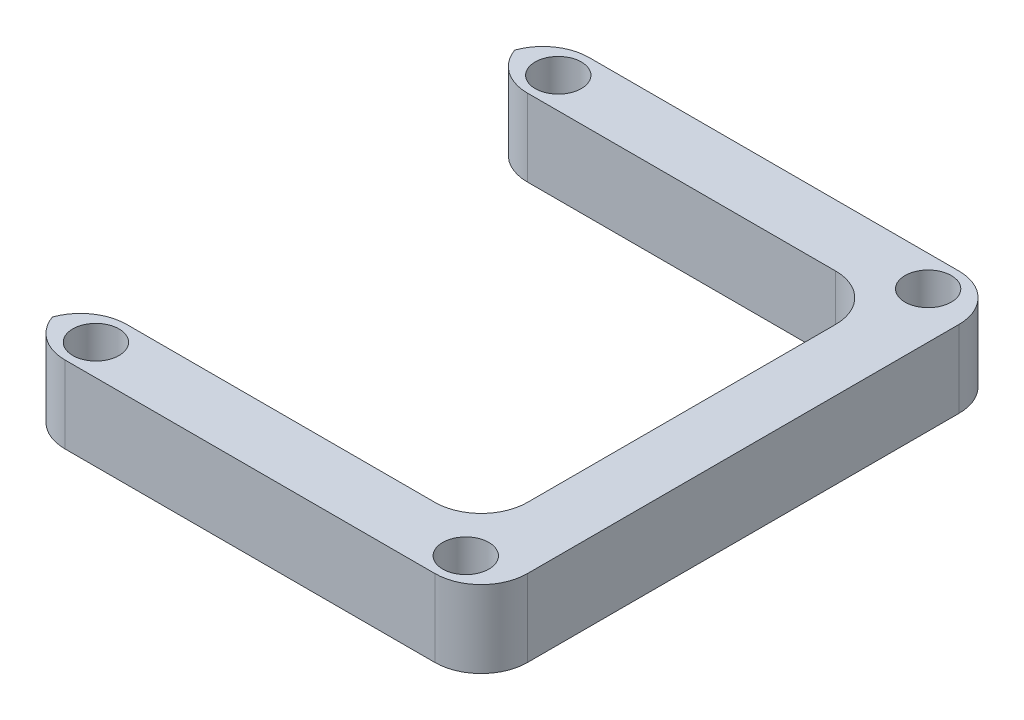
from build123d import *

# Parameters (mm, degrees)
SKETCH1_R           = 1.5
BOSS_EXTRUDE1_DEPTH = 5
FILLET2_R           = 3


with BuildPart() as part:
    # Sketch1 → Boss-Extrude1 (new body)
    with BuildSketch(Plane(origin=(0, 0, 0), x_dir=(1, 0, 0), z_dir=(0, 1, 0))):
        Polygon((0, 30), (0, 34), (30, 34), (30, 0), (0, 0), (0, 4), (26, 4), (26, 30), align=None)
        with Locations(Location((27, 2, 0), (0, 0, 270))):
            Circle(SKETCH1_R, mode=Mode.SUBTRACT)
        with Locations(Location((27, 32, 0), (0, 0, 270))):
            Circle(SKETCH1_R, mode=Mode.SUBTRACT)
        with Locations(Location((3, 32, 0), (0, 0, 270))):
            Circle(SKETCH1_R, mode=Mode.SUBTRACT)
        with Locations(Location((3, 2, 0), (0, 0, 270))):
            Circle(SKETCH1_R, mode=Mode.SUBTRACT)
    extrude(amount=BOSS_EXTRUDE1_DEPTH)

    # Fillet2
    # the kernel refuses this fillet: 3 mm, written as the material it adds along each edge
    with BuildSketch(Plane(origin=(26, 0, -30), x_dir=(0, 0, 1), z_dir=(0, 1, 0)), Plane(origin=(26, 0, -4), x_dir=(-1, 0, 0), z_dir=(0, 1, 0))) as fillet2_piece_1:
        with BuildLine():
            CenterArc((FILLET2_R, -FILLET2_R), FILLET2_R, 90, 90)
            Line((0, -FILLET2_R), (0, 0))
            Line((0, 0), (FILLET2_R, 0))
        make_face()
    extrude(amount=5)
    # the kernel refuses this fillet: 3 mm, written as the material it takes off along each edge
    with BuildSketch(Plane(origin=(30, -7.5, -34), x_dir=(-1, 0, 0), z_dir=(0, 1, 0)), Plane(origin=(0, -7.5, -34), x_dir=(0, 0, 1), z_dir=(0, 1, 0)), Plane(origin=(0, -7.5, -4), x_dir=(0, 0, 1), z_dir=(0, 1, 0)), Plane(origin=(0, -7.5, 0), x_dir=(1, 0, 0), z_dir=(0, 1, 0)), Plane(origin=(30, -7.5, 0), x_dir=(0, 0, -1), z_dir=(0, 1, 0))) as fillet2_2_piece_1:
        with BuildLine():
            CenterArc((FILLET2_R, FILLET2_R), FILLET2_R, 180, 90)
            Line((0, FILLET2_R), (0, 0))
            Line((0, 0), (FILLET2_R, 0))
        make_face()
    extrude(amount=20, mode=Mode.SUBTRACT)
    with BuildSketch(Plane(origin=(0, -7.5, -30), x_dir=(0, 0, -1), z_dir=(0, 1, 0))) as fillet2_2_piece_2:
        with BuildLine():
            CenterArc((FILLET2_R, -FILLET2_R), FILLET2_R, 90, 90)
            Line((0, -FILLET2_R), (0, 0))
            Line((0, 0), (FILLET2_R, 0))
        make_face()
    extrude(amount=20, mode=Mode.SUBTRACT)


solid = part.part
